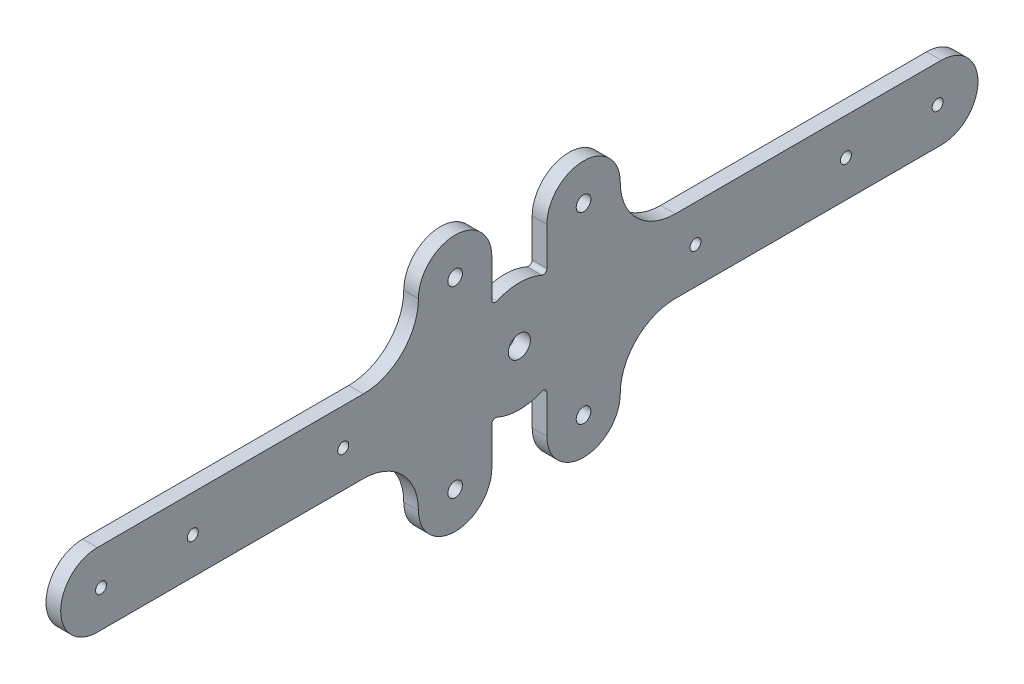
from build123d import *

# Parameters (mm, degrees)
SKETCH1_W            = 250
SKETCH1_H            = 75
BOSS_EXTRUDE1_DEPTH  = 4
SKETCH2_R            = 3
SKETCH2_R_2          = 1.5
CUT_EXTRUDE1_DEPTH   = 131.565117853
SKETCH3_R            = 2
CUT_EXTRUDE2_DEPTH   = 131.565117853
CUT_EXTRUDE3_DEPTH   = 131.565117853
FILLET1_R            = 1
FILLET1_OF_MIRROR2_R = 1
MIRROR3_OUTLINE_R    = 1.5
MIRROR3_OUTLINE_R_2  = 2
MIRROR3_DEPTH        = 4


# Read off the part's stored shape, not the designer's step: Mirror3
with BuildPart() as part:
    # Sketch1 → Boss-Extrude1 (new body)
    with BuildSketch(Plane(origin=(0, 0, 0), x_dir=(0, 0, -1), z_dir=(1, 0, 0))):
        Rectangle(SKETCH1_W, SKETCH1_H)
    extrude(amount=BOSS_EXTRUDE1_DEPTH)

    # Sketch2 → Cut-Extrude1 (cut, through all)
    with BuildSketch(Plane(origin=(4, 0, 0), x_dir=(0, 0, -1), z_dir=(1, 0, 0))):
        Circle(SKETCH2_R)
        with Locations((-48, 0)):
            Circle(SKETCH2_R_2)
        with Locations((-89, 0)):
            Circle(SKETCH2_R_2)
        with Locations((-114, 0)):
            Circle(SKETCH2_R_2)
    extrude(amount=-CUT_EXTRUDE1_DEPTH, mode=Mode.SUBTRACT)

    # Sketch3 → Cut-Extrude2 (cut, through all)
    with BuildSketch(Plane(origin=(4, 0, 0), x_dir=(0, 0, -1), z_dir=(1, 0, 0))):
        with Locations((-17.5, 25)):
            Circle(SKETCH3_R)
    cut_extrude2 = extrude(amount=-CUT_EXTRUDE2_DEPTH, mode=Mode.SUBTRACT)

    # Sketch4 → Cut-Extrude3 (cut, through all)
    with BuildSketch(Plane(origin=(4, 0, 0), x_dir=(0, 0, -1), z_dir=(1, 0, 0))):
        with BuildLine():
            Line((-115, 10), (-42.5, 10))
            ThreePointArc((-42.5, 10), (-31.893398282, 14.393398282), (-27.5, 25))
            ThreePointArc((-27.5, 25), (-17.5, 35), (-7.5, 25))
            Line((-7.5, 25), (-7.5, 13))
            ThreePointArc((-7.5, 13), (-3.882119057, 14.497556747), (0, 15.00833102))
            Line((0, 15.00833102), (0, 37.5))
            Line((0, 37.5), (-125, 37.5))
            Line((-125, 37.5), (-125, 0))
            ThreePointArc((-125, 0), (-122.071067812, 7.071067812), (-115, 10))
        make_face()
    cut_extrude3 = extrude(amount=-CUT_EXTRUDE3_DEPTH, mode=Mode.SUBTRACT)

    # Fillet1
    fillet1_edges = [part.edges().sort_by_distance(p)[0] for p in [
        (2, 13, 7.5),
    ]]
    fillet(fillet1_edges, radius=FILLET1_R)

    # Mirror2: Cut-Extrude2, Cut-Extrude3 across plane
    add(cut_extrude2.mirror(Plane.ZX), mode=Mode.SUBTRACT)
    add(cut_extrude3.mirror(Plane.ZX), mode=Mode.SUBTRACT)

    # Fillet1 of Mirror2
    fillet1_of_mirror2_edges = [part.edges().sort_by_distance(p)[0] for p in [
        (2, -13, 7.5),
    ]]
    fillet(fillet1_of_mirror2_edges, radius=FILLET1_OF_MIRROR2_R)

    # Mirror3 outline → Mirror3 (cut)
    with BuildSketch(Plane.YZ):
        with BuildLine():
            Line((-37.5, -125), (-3.5e-08, -125))
            ThreePointArc((-3.5e-08, -125), (-7.071067824, -122.071067799), (-10, -115))
            Line((-10, -115), (-10, -42.5))
            ThreePointArc((-10, -42.5), (-14.393398282, -31.893398282), (-25, -27.5))
            ThreePointArc((-25, -27.5), (-35, -17.5), (-25, -7.5))
            Line((-25, -7.5), (-14.629308324, -7.5))
            ThreePointArc((-14.629308324, -7.5), (-13.790845868, -7.044959365), (-13.715452388, -6.09396142))
            ThreePointArc((-13.715452388, -6.09396142), (-14.681553895, -3.114799389), (-15.00833102, 0))
            Line((-15.00833102, 0), (-37.5, 0))
            Line((-37.5, 0), (-37.5, -125))
        make_face()
        with BuildLine():
            ThreePointArc((15.00833102, 0), (14.681553895, -3.114799389), (13.715452388, -6.09396142))
            ThreePointArc((13.715452388, -6.09396142), (13.790845868, -7.044959365), (14.629308324, -7.5))
            Line((14.629308324, -7.5), (25, -7.5))
            ThreePointArc((25, -7.5), (35, -17.5), (25, -27.5))
            ThreePointArc((25, -27.5), (14.393398282, -31.893398282), (10, -42.5))
            Line((10, -42.5), (10, -115))
            ThreePointArc((10, -115), (7.071067799, -122.071067824), (-3.5e-08, -125))
            Line((-3.5e-08, -125), (37.5, -125))
            Line((37.5, -125), (37.5, 0))
            Line((37.5, 0), (15.00833102, 0))
        make_face()
        with Locations((0, -114)):
            Circle(MIRROR3_OUTLINE_R)
        with Locations((0, -89)):
            Circle(MIRROR3_OUTLINE_R)
        with Locations((0, -48)):
            Circle(MIRROR3_OUTLINE_R)
        with Locations((25, -17.5)):
            Circle(MIRROR3_OUTLINE_R_2)
        with Locations((-25, -17.5)):
            Circle(MIRROR3_OUTLINE_R_2)
    extrude(amount=MIRROR3_DEPTH, mode=Mode.SUBTRACT)


solid = part.part
